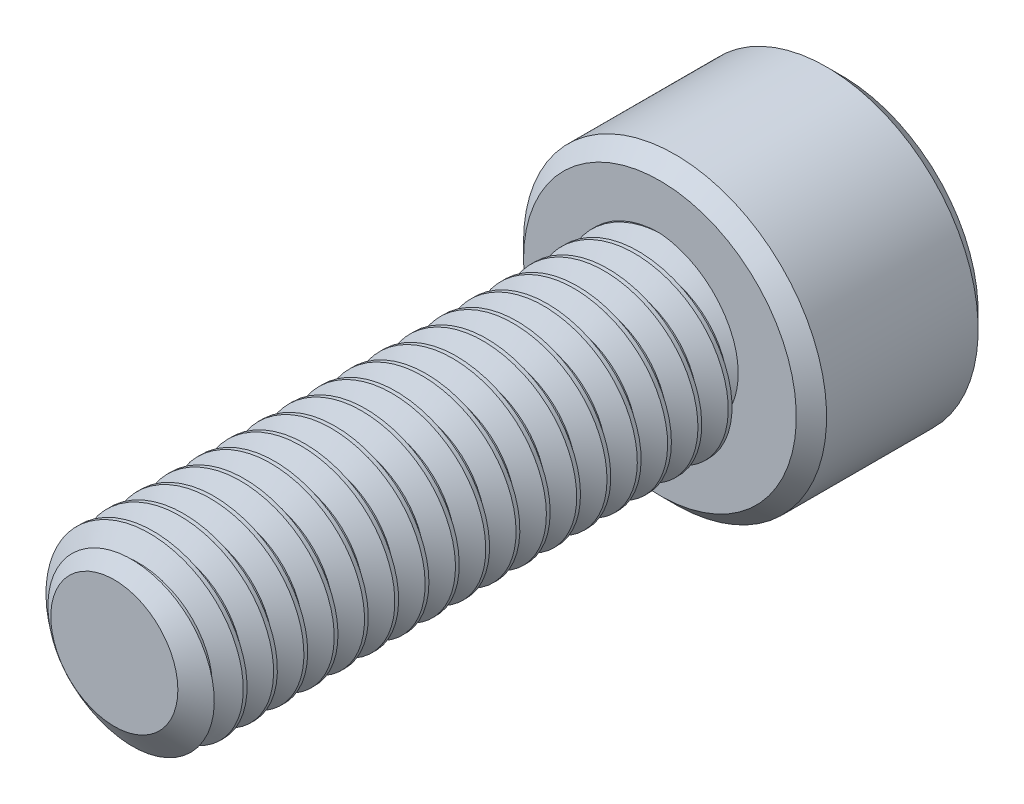
from build123d import *

# Parameters (mm, degrees)
SKETCH1_R          = 3
EXTRUDE1_DEPTH     = 18
CUT_SWEEP1_PITCH   = 1
SKETCH6_R          = 5
EXTRUDE2_DEPTH     = 6
CUT_EXTRUDE1_DEPTH = 3.75
CHAMFER1_SIZE      = 0.5


with BuildPart() as part:
    # Sketch1 → Extrude1 (new body)
    with BuildSketch(Plane.XY):
        Circle(SKETCH1_R)
    extrude(amount=-EXTRUDE1_DEPTH)

    # Cut-Sweep1: the profile of Sketch3 profile screwed along a right-hand helix of 19 turns, 6 arcs to a turn; built about Z, then put on its axis
    cut_sweep1_z = Axis((0, 0, 0), (0, 0, 1))
    cut_sweep1_corners = [(3.0003, 0, -0.875173205), (2.350480947, 0, -0.5), (2.350480947, 0, -0.375), (3.0003, 0, 0.000173205)]
    with BuildLine(mode=Mode.PRIVATE) as cut_sweep1_profile:
        Line(cut_sweep1_corners[0], cut_sweep1_corners[1])
        Line(cut_sweep1_corners[1], cut_sweep1_corners[2])
        Line(cut_sweep1_corners[2], cut_sweep1_corners[3])
        Line(cut_sweep1_corners[3], cut_sweep1_corners[0])
    cut_sweep1_cap = Face(cut_sweep1_profile.wire())
    cut_sweep1_turn_angles = [0, 30, 60, 90, 120, 150, 180, 210, 240, 270, 300, 330, 360]
    cut_sweep1_turn_weights = [1, 0.8660254037844387, 1, 0.8660254037844387, 1, 0.8660254037844387, 1, 0.8660254037844387, 1, 0.8660254037844387, 1, 0.8660254037844387, 1]
    cut_sweep1_turn_rails = [Edge.make_bspline([Vector(p[0], p[1], 0).rotate(cut_sweep1_z, cut_sweep1_turn_angles[k]) / cut_sweep1_turn_weights[k] + Vector(0, 0, p[2] + CUT_SWEEP1_PITCH * cut_sweep1_turn_angles[k] / 360) for k in range(13)], [0, 0, 0, 1, 1, 2, 2, 3, 3, 4, 4, 5, 5, 6, 6, 6], 2, cut_sweep1_turn_weights) for p in cut_sweep1_corners]
    cut_sweep1_turn_sides = [Face.make_surface_from_curves(cut_sweep1_turn_rails[p[0]], cut_sweep1_turn_rails[p[1]]) for p in [(0, 1), (1, 2), (2, 3), (3, 0)]]
    cut_sweep1 = Plane(origin=(0, 0, 0), x_dir=(0, 1, 0), z_dir=(0, 0, -1)) * Solid(Shell([*[p.moved(Location((0, 0, CUT_SWEEP1_PITCH * i))) for i in range(19) for p in cut_sweep1_turn_sides], cut_sweep1_cap, cut_sweep1_cap.rotate(cut_sweep1_z, 6840).moved(Location((0, 0, CUT_SWEEP1_PITCH * 6840 / 360)))]))
    add(cut_sweep1, mode=Mode.SUBTRACT)

    # Sketch4 → Cut-Revolve1 (revolve, cut)
    with BuildSketch(Plane(origin=(0, 0, 0), x_dir=(0, 0, -1), z_dir=(1, 0, 0)), mode=Mode.PRIVATE) as cut_revolve1_sk:
        Polygon((0.632650852, 3), (0, 2.096480947), (0, 3), align=None)
    revolve(cut_revolve1_sk.sketch.rotate(Axis((0, 0, 0), (0, 0, -1)), 244.349292568), axis=Axis((0, 0, 0), (0, 0, -1)), mode=Mode.SUBTRACT)

    # Sketch6 → Extrude2 (add)
    with BuildSketch(Plane(origin=(0, 0, -18), x_dir=(-1, 0, 0), z_dir=(0, 0, -1))):
        Circle(SKETCH6_R)
    extrude(amount=EXTRUDE2_DEPTH)

    # Sketch7 → Cut-Extrude1 (cut)
    with BuildSketch(Plane(origin=(0, 0, -24), x_dir=(-1, 0, 0), z_dir=(0, 0, -1))):
        Polygon((0, 2.886751346), (-2.5, 1.443375673), (-2.5, -1.443375673), (0, -2.886751346), (2.5, -1.443375673), (2.5, 1.443375673), align=None)
    extrude(amount=-CUT_EXTRUDE1_DEPTH, mode=Mode.SUBTRACT)

    # Cut-Extrude2 cone 1 section (through the dimple's axis) → Cut-Extrude2 (revolve, cut)
    with BuildSketch(Plane(origin=(0, 0, -24), x_dir=(0, 1, 0), z_dir=(1, 0, 0))):
        Polygon((0, 0), (2.886751346, 0), (0, 2.886751346), align=None)
    revolve(axis=Axis((0, 0, -24), (0, 0, 1)), mode=Mode.SUBTRACT)

    # Chamfer1
    chamfer1_edges = [part.edges().sort_by_distance(p)[0] for p in [
        (5, 0, -18),
        (5, 0, -24),
    ]]
    chamfer(chamfer1_edges, length=CHAMFER1_SIZE)


solid = part.part
